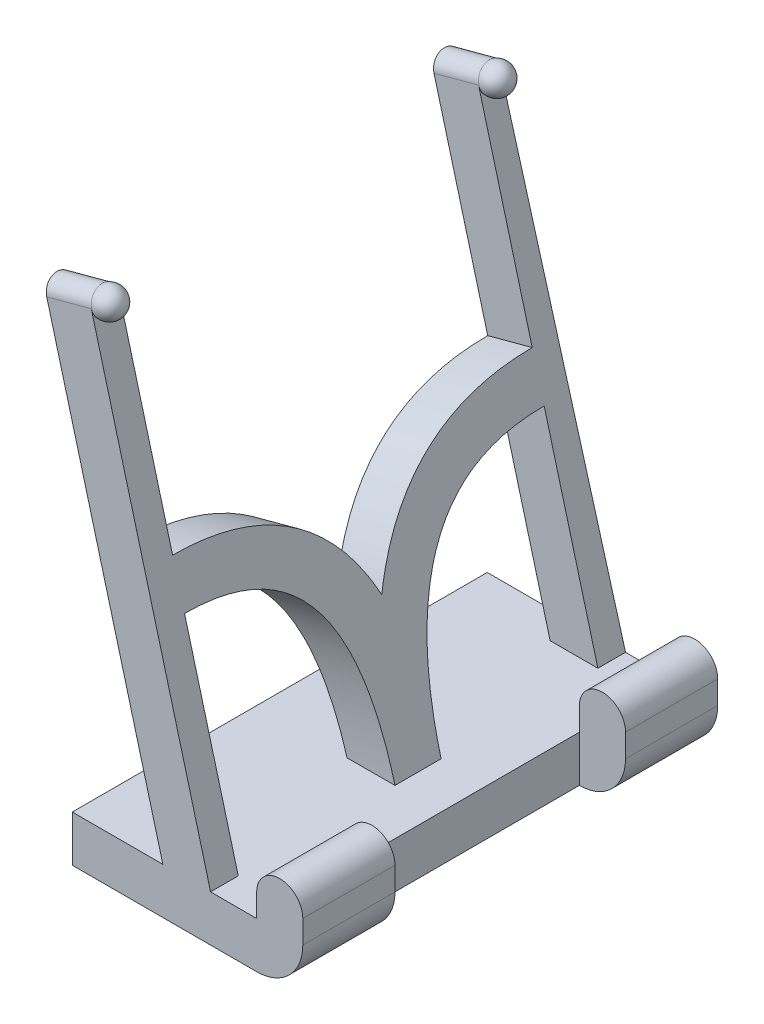
from build123d import *

# Parameters (mm, degrees)
BOSS_EXTRUDE1_DEPTH = 10
SKETCH2_3_W         = 10
SKETCH2_3_H         = 20
BOSS_EXTRUDE2_DEPTH = 20
BOSS_EXTRUDE3_START = -10
BOSS_EXTRUDE3_DEPTH = 10
SKETCH8_R           = 3
BOSS_EXTRUDE5_DEPTH = 0.1
DOME2_FACE_RADIUS   = 3
DOME2_HEIGHT        = 4
DOME3_FACE_RADIUS   = 3
DOME3_HEIGHT        = 4
FILLET1_RADIUS      = 5
FILLET1_LENGTH      = 20
FILLET2_RADIUS      = 5
FILLET2_LENGTH      = 20
FILLET3_R           = 10
FILLET4_R           = 10


# Read off the part's stored shape, not the designer's step: Boss-Extrude3
with BuildPart() as part:
    # Sketch2 → Boss-Extrude1 (new body)
    with BuildSketch(Plane(origin=(0, 0, 0), x_dir=(1, 0, 0), z_dir=(0, 1, 0))):
        Polygon((-10, 45), (-50, 45), (-50, -45), (-10, -45), (-10, -25), (-10, 25), align=None)
    extrude(amount=BOSS_EXTRUDE1_DEPTH)

    # Sketch2<3> → Boss-Extrude2 (add)
    with BuildSketch(Plane(origin=(0, 0, 0), x_dir=(1, 0, 0), z_dir=(0, 1, 0))):
        with Locations((-5, -35)):
            Rectangle(SKETCH2_3_W, SKETCH2_3_H)
        with Locations((-5, 35)):
            Rectangle(SKETCH2_3_W, SKETCH2_3_H)
    extrude(amount=BOSS_EXTRUDE2_DEPTH)

    # Boss-Extrude3 outline → Boss-Extrude3 (add)
    with BuildSketch(Plane(origin=(-16.160254038, -4.330127019, 0), x_dir=(0, 0, -1), z_dir=(0.9659258262890681, 0.25881904510252135, 0)).offset(BOSS_EXTRUDE3_START)):
        with BuildLine():
            Line((-45, 114.835639165), (-45, 14.835639165))
            Line((-45, 14.835639165), (-39, 14.835639165))
            Line((-39, 14.835639165), (-39, 59.835639165))
            Line((-39, 59.835639165), (-39, 69.835639165))
            Line((-39, 69.835639165), (-39, 114.835639165))
            ThreePointArc((-39, 114.835639165), (-42, 117.835639165), (-45, 114.835639165))
        make_face()
        with BuildLine():
            Line((-39, 69.835639165), (-39, 59.835639165))
            add(Edge.make_bspline(
                [(-39, 59.835639165), (-32.29466778, 59.812740608), (-23.746310881, 57.26615983), (-18.155959882, 54.002687415), (-13.581360263, 49.447869434), (-9.895970778, 43.393937355), (-7.1466079, 35.668544709), (-5.009950643, 23.851055873), (-5, 14.835639165)],
                knots=[0, 0, 0, 0.1875, 0.3125, 0.4375, 0.5625, 0.6875, 0.8125, 1, 1, 1], degree=2))
            Line((-5, 14.835639165), (5, 14.835639165))
            add(Edge.make_bspline(
                [(0.000646167, 45.244430902), (0.476875904, 44.083141287), (2.5762954, 38.143358621), (5.009950643, 24.570222457), (5, 14.835639165)],
                knots=[0.655563959, 0.655563959, 0.655563959, 0.6875, 0.8125, 1, 1, 1], degree=2))
            add(Edge.make_bspline(
                [(0.000646167, 45.244430902), (0.000323073, 45.243642557), (0, 45.24285419)],
                knots=[0.655550731, 0.655550731, 0.655550731, 0.655572405, 0.655572405, 0.655572405], degree=2))
            add(Edge.make_bspline(
                [(-39, 69.835639165), (-31.080450951, 69.858370058), (-19.824359781, 66.54538789), (-12.00867454, 61.996263654), (-5.614755257, 55.613542625), (-1.387837079, 48.627543749), (0, 45.24285419)],
                knots=[0, 0, 0, 0.1875, 0.3125, 0.4375, 0.5625, 0.655579399, 0.655579399, 0.655579399], degree=2))
        make_face()
        with BuildLine():
            add(Edge.make_bspline(
                [(39, 69.835639165), (36.362179487, 69.835639165), (28.828562218, 69.197832663), (19.824098622, 66.545415855), (12.008024479, 61.996828001), (5.61432407, 55.613689023), (1.991176128, 49.630689625), (0.466161192, 46.380278102), (0.000646167, 45.244430902)],
                knots=[0, 0, 0, 0.0625, 0.1875, 0.3125, 0.4375, 0.5625, 0.624322405, 0.655550731, 0.655550731, 0.655550731], degree=2))
            add(Edge.make_bspline(
                [(0.000646167, 45.244430902), (0.476875904, 44.083141287), (2.5762954, 38.143358621), (5.009950643, 24.570222457), (5, 14.835639165)],
                knots=[0.655563959, 0.655563959, 0.655563959, 0.6875, 0.8125, 1, 1, 1], degree=2))
            add(Edge.make_bspline(
                [(39, 59.835639165), (32.29466778, 59.812740608), (23.746310881, 57.26615983), (18.155959882, 54.002687415), (13.581360263, 49.447869434), (9.895970778, 43.393937355), (7.1466079, 35.668544709), (5.009950643, 23.851055873), (5, 14.835639165)],
                knots=[0, 0, 0, 0.1875, 0.3125, 0.4375, 0.5625, 0.6875, 0.8125, 1, 1, 1], degree=2))
            Line((39, 59.835639165), (39, 69.835639165))
        make_face()
        with BuildLine():
            Line((39, 114.835639165), (39, 69.835639165))
            Line((39, 69.835639165), (39, 59.835639165))
            Line((39, 59.835639165), (39, 14.835639165))
            Line((39, 14.835639165), (45, 14.835639165))
            Line((45, 14.835639165), (43.851535226, 117.196108886))
            ThreePointArc((43.851535226, 117.196108886), (40.687484415, 117.533286814), (39, 114.835639165))
        make_face()
    extrude(amount=BOSS_EXTRUDE3_DEPTH)

    # Sketch8 → Boss-Extrude5 (add)
    with BuildSketch(Plane(origin=(-16.160254038, -4.330127019, 0), x_dir=(0, 0, -1), z_dir=(0.9659258262890682, 0.2588190451025214, 0))):
        with Locations(Location((-42, 114.835639165, 0), (0, 0, 90))):
            Circle(SKETCH8_R)
        with Locations(Location((42, 114.835639165, 0), (0, 0, 51.889621563))):
            Circle(SKETCH8_R)
    extrude(amount=BOSS_EXTRUDE5_DEPTH)

    # Dome2: a dome of height H over a round flat face of radius A is a cap of a sphere of radius (A * A + H * H) / (2 * H)
    dome2_r = (DOME2_FACE_RADIUS * DOME2_FACE_RADIUS + DOME2_HEIGHT * DOME2_HEIGHT) / (2 * DOME2_HEIGHT)
    dome2_base = Plane((-45.785311928, 106.618464533, 42), z_dir=(0.965925826289, 0.258819045103, 0))
    with Locations(dome2_base.offset(DOME2_HEIGHT - dome2_r)):
        dome2_ball = Sphere(dome2_r, mode=Mode.PRIVATE)
    add(split(dome2_ball, bisect_by=dome2_base, keep=Keep.TOP, mode=Mode.PRIVATE))

    # Dome3: a dome of height H over a round flat face of radius A is a cap of a sphere of radius (A * A + H * H) / (2 * H)
    dome3_r = (DOME3_FACE_RADIUS * DOME3_FACE_RADIUS + DOME3_HEIGHT * DOME3_HEIGHT) / (2 * DOME3_HEIGHT)
    dome3_base = Plane((-45.785311928, 106.618464533, -42), z_dir=(0.965925826289, 0.258819045103, 0))
    with Locations(dome3_base.offset(DOME3_HEIGHT - dome3_r)):
        dome3_ball = Sphere(dome3_r, mode=Mode.PRIVATE)
    add(split(dome3_ball, bisect_by=dome3_base, keep=Keep.TOP, mode=Mode.PRIVATE))

    # Fillet1: full round fillet: the end face becomes a half cylinder, R = half its width
    fillet1_face = Plane((-5, 20, -35), x_dir=(0, 0, -1), z_dir=(0, 1, 0))  # on the end face: x along it, z out of the body
    fillet1_slab = fillet1_face.offset(-FILLET1_RADIUS / 2) * Box(FILLET1_LENGTH, 2 * FILLET1_RADIUS, FILLET1_RADIUS, mode=Mode.PRIVATE)  # the body's end, R deep
    fillet1_round = Plane((-5, 15, -35), x_dir=(0, 1, 0), z_dir=(0, 0, -1)) * Cylinder(FILLET1_RADIUS, FILLET1_LENGTH, mode=Mode.PRIVATE)  # its axis R under the face
    add(fillet1_slab - fillet1_round, mode=Mode.SUBTRACT)

    # Fillet2: full round fillet: the end face becomes a half cylinder, R = half its width
    fillet2_face = Plane((-5, 20, 35), x_dir=(0, 0, 1), z_dir=(0, 1, 0))  # on the end face: x along it, z out of the body
    fillet2_slab = fillet2_face.offset(-FILLET2_RADIUS / 2) * Box(FILLET2_LENGTH, 2 * FILLET2_RADIUS, FILLET2_RADIUS, mode=Mode.PRIVATE)  # the body's end, R deep
    fillet2_round = Plane((-5, 15, 35), x_dir=(0, 1, 0), z_dir=(0, 0, 1)) * Cylinder(FILLET2_RADIUS, FILLET2_LENGTH, mode=Mode.PRIVATE)  # its axis R under the face
    add(fillet2_slab - fillet2_round, mode=Mode.SUBTRACT)

    # Fillet3
    fillet3_edges = [part.edges().sort_by_distance(p)[0] for p in [
        (0, 0, 35),
    ]]
    fillet(fillet3_edges, radius=FILLET3_R)

    # Fillet4
    fillet4_edges = [part.edges().sort_by_distance(p)[0] for p in [
        (0, 0, -35),
    ]]
    fillet(fillet4_edges, radius=FILLET4_R)


solid = part.part
